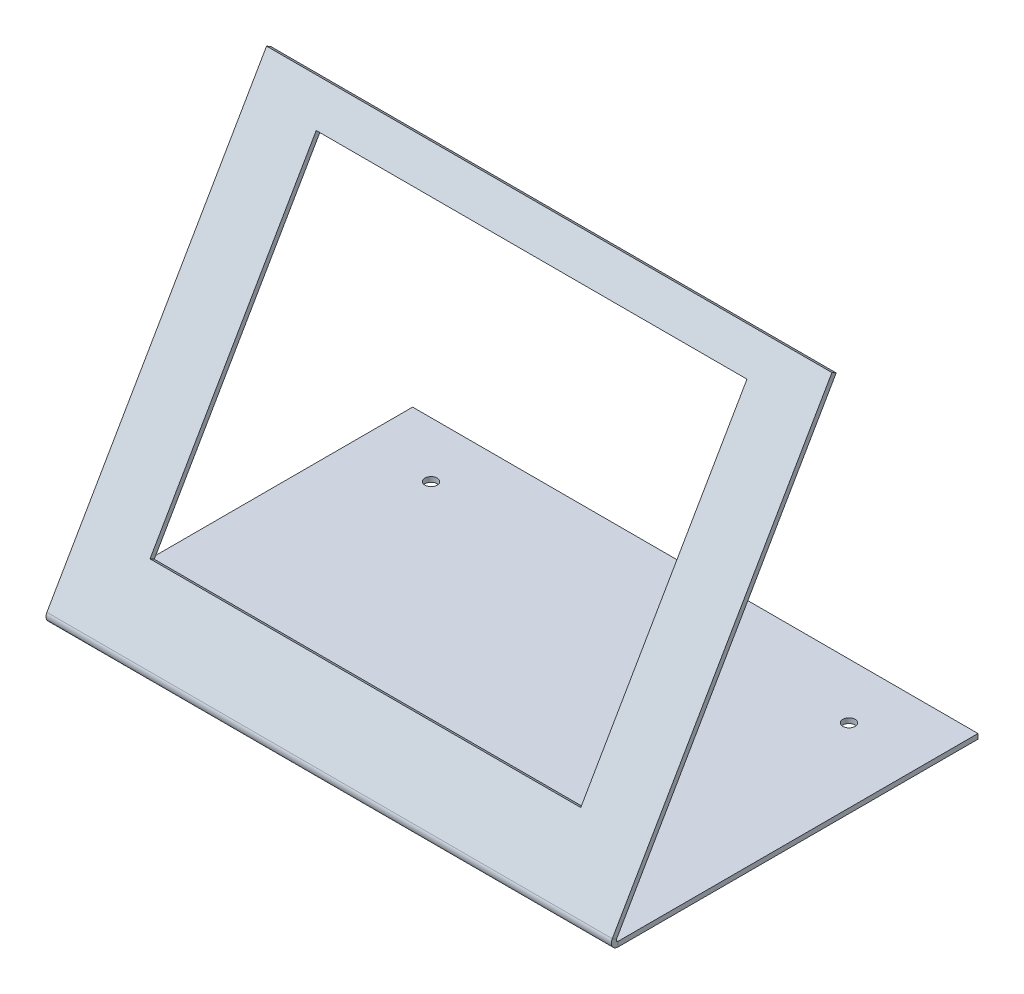
from build123d import *

# Parameters (mm, degrees)
ESBO_O1_W              = 230
ESBO_O1_H              = 150
ESBO_O1_R              = 2.5
FLANGE_BASE1_DEPTH     = 2
ARESTA_FLANGE1_DEPTH   = 230
ARESTA_FLANGE1_2_DEPTH = 230
CORTE_EXTRUS_O1_REACH  = 274.044
ESBO_O11_W             = 175.23
ESBO_O11_H             = 135.23


# Read off the part's stored shape, not the designer's step: Aresta-Flange1
# Sheet-metal steps are written as plain solids
with BuildPart() as part:
    # Esboço1 → Flange-base1 (new body)
    with BuildSketch(Plane(origin=(0, 0, 0), x_dir=(1, 0, 0), z_dir=(0, 1, 0))):
        with Locations((115, -75)):
            Rectangle(ESBO_O1_W, ESBO_O1_H)
        with Locations(Location((30, -22.5, 0), (0, 0, 270))):
            Circle(ESBO_O1_R, mode=Mode.SUBTRACT)
        with Locations(Location((30, -127.5, 0), (0, 0, 270))):
            Circle(ESBO_O1_R, mode=Mode.SUBTRACT)
        with Locations(Location((200, -127.5, 0), (0, 0, 270))):
            Circle(ESBO_O1_R, mode=Mode.SUBTRACT)
        with Locations(Location((200, -22.5, 0), (0, 0, 270))):
            Circle(ESBO_O1_R, mode=Mode.SUBTRACT)
    extrude(amount=-FLANGE_BASE1_DEPTH)

    # Aresta-Flange1 outline → Aresta-Flange1 (cut)
    with BuildSketch(Plane.YZ):
        with BuildLine():
            ThreePointArc((-2, 146.414770298), (-1.443395312, 148.069037507), (0, 149.050372696))
            Line((0, 149.050372696), (0, 150))
            Line((0, 150), (-2, 150))
            Line((-2, 150), (-2, 146.414770298))
        make_face()
    extrude(amount=ARESTA_FLANGE1_DEPTH, mode=Mode.SUBTRACT)

    # Aresta-Flange1 2 outline → Aresta-Flange1 2 (add)
    with BuildSketch(Plane.YZ):
        with BuildLine():
            Line((156.884572681, 59.422649731), (2.1049, 148.784735418))
            ThreePointArc((2.1049, 148.784735418), (1.079239772, 149.129835223), (0, 149.050372696))
            Line((0, 149.050372696), (0, 146.414770298))
            ThreePointArc((0, 146.414770298), (0.3683, 147.052684611), (1.1049, 147.052684611))
            Line((1.1049, 147.052684611), (155.884572681, 57.690598923))
            Line((155.884572681, 57.690598923), (156.884572681, 59.422649731))
        make_face()
    extrude(amount=ARESTA_FLANGE1_2_DEPTH)

    # Esboço11 → Corte-extrusão1 (cut, up to next)
    with BuildSketch(Plane(origin=(0, 64.951905284, 112.5), x_dir=(1, 0, 0), z_dir=(0, 0.499999999999998, 0.8660254037844398)), mode=Mode.PRIVATE) as corte_extrus_o1_sk1:
        with Locations((115, 24.177614851)):
            Rectangle(ESBO_O11_W, ESBO_O11_H)
    corte_extrus_o1_tool1 = extrude(corte_extrus_o1_sk1.sketch, amount=-CORTE_EXTRUS_O1_REACH, mode=Mode.PRIVATE) & part.part
    add(corte_extrus_o1_tool1.solids().sort_by_distance((115, 85.890334, 100.411193))[0], mode=Mode.SUBTRACT)


solid = part.part
